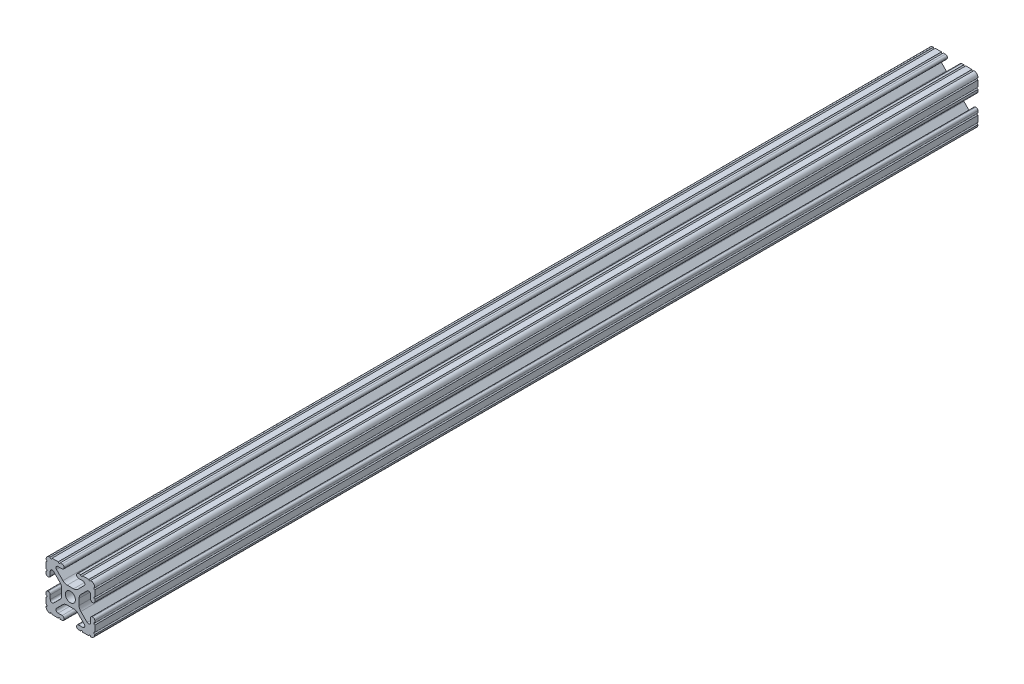
from build123d import *

# Parameters (mm, degrees)
SKETCH1_R           = 2.6035
BOSS_EXTRUDE1_DEPTH = 229.87


with BuildPart() as part:
    # Sketch1 → Boss-Extrude1 (new, symmetric)
    with BuildSketch(Plane.XY):
        with BuildLine():
            Line((-7.179650497, -8.645192506), (-3.952270251, -5.423690499))
            ThreePointArc((-3.952270251, -5.423690499), (-2.922936451, -4.736929036), (-1.709253557, -4.4958))
            Line((-1.709253557, -4.4958), (1.709253557, -4.4958))
            ThreePointArc((1.709253557, -4.4958), (2.922936451, -4.736929036), (3.952270251, -5.423690499))
            Line((3.952270251, -5.423690499), (7.179650497, -8.645192506))
            ThreePointArc((7.179650497, -8.645192506), (7.41473083, -9.822813117), (6.416408329, -10.4902))
            Line((6.416408329, -10.4902), (4.287512407, -10.4902))
            ThreePointArc((4.287512407, -10.4902), (3.54574862, -10.79744862), (3.2385, -11.539212407))
            Line((3.2385, -11.539212407), (3.2385, -11.650987593))
            ThreePointArc((3.2385, -11.650987593), (3.54574862, -12.39275138), (4.287512407, -12.7))
            Line((4.287512407, -12.7), (5.317126718, -12.7))
            ThreePointArc((5.317126718, -12.7), (5.825126718, -12.192), (6.333126718, -12.7))
            Line((6.333126718, -12.7), (9.550443118, -12.7))
            ThreePointArc((9.550443118, -12.7), (10.058366869, -12.192000006), (10.566443095, -12.699847501))
            ThreePointArc((10.566443095, -12.699847501), (12.082537762, -12.08250727), (12.699846982, -10.566399977))
            ThreePointArc((12.699846982, -10.566399977), (12.192000006, -10.058323491), (12.7, -9.5504))
            Line((12.7, -9.5504), (12.7, -6.3330836))
            ThreePointArc((12.7, -6.3330836), (12.192, -5.8250836), (12.7, -5.3170836))
            Line((12.7, -5.3170836), (12.7, -4.287469289))
            ThreePointArc((12.7, -4.287469289), (12.39275138, -3.545705502), (11.650987593, -3.238456882))
            Line((11.650987593, -3.238456882), (11.539212407, -3.238456882))
            ThreePointArc((11.539212407, -3.238456882), (10.79744862, -3.545705502), (10.4902, -4.287469289))
            Line((10.4902, -4.287469289), (10.4902, -6.402089023))
            ThreePointArc((10.4902, -6.402089023), (9.856505071, -7.351067942), (8.737131347, -7.129408934))
            Line((8.737131347, -7.129408934), (5.441005833, -3.840816462))
            ThreePointArc((5.441005833, -3.840816462), (4.750877967, -2.809883091), (4.5085, -1.593185507))
            Line((4.5085, -1.593185507), (4.5085, 1.593185507))
            ThreePointArc((4.5085, 1.593185507), (4.750877967, 2.809883091), (5.441005833, 3.840816462))
            Line((5.441005833, 3.840816462), (8.737131347, 7.129408934))
            ThreePointArc((8.737131347, 7.129408934), (9.856505071, 7.351067942), (10.4902, 6.402089023))
            Line((10.4902, 6.402089023), (10.4902, 4.287469289))
            ThreePointArc((10.4902, 4.287469289), (10.79744862, 3.545705502), (11.539212407, 3.238456882))
            Line((11.539212407, 3.238456882), (11.650987593, 3.238456882))
            ThreePointArc((11.650987593, 3.238456882), (12.39275138, 3.545705502), (12.7, 4.287469289))
            Line((12.7, 4.287469289), (12.7, 5.3170836))
            ThreePointArc((12.7, 5.3170836), (12.192, 5.8250836), (12.7, 6.3330836))
            Line((12.7, 6.3330836), (12.7, 9.5504))
            ThreePointArc((12.7, 9.5504), (12.192000006, 10.058323491), (12.699846982, 10.566399977))
            ThreePointArc((12.699846982, 10.566399977), (12.082537762, 12.08250727), (10.566443095, 12.699847501))
            ThreePointArc((10.566443095, 12.699847501), (10.058366869, 12.192000006), (9.550443118, 12.7))
            Line((9.550443118, 12.7), (6.333126718, 12.7))
            ThreePointArc((6.333126718, 12.7), (5.825126718, 12.192), (5.317126718, 12.7))
            Line((5.317126718, 12.7), (4.287512407, 12.7))
            ThreePointArc((4.287512407, 12.7), (3.54574862, 12.39275138), (3.2385, 11.650987593))
            Line((3.2385, 11.650987593), (3.2385, 11.539212407))
            ThreePointArc((3.2385, 11.539212407), (3.54574862, 10.79744862), (4.287512407, 10.4902))
            Line((4.287512407, 10.4902), (6.476788598, 10.4902))
            ThreePointArc((6.476788598, 10.4902), (7.432222385, 9.85140422), (7.207036008, 8.724370562))
            Line((7.207036008, 8.724370562), (3.898272566, 5.423169045))
            ThreePointArc((3.898272566, 5.423169045), (2.869120213, 4.736787962), (1.655778399, 4.4958))
            Line((1.655778399, 4.4958), (-1.655778399, 4.4958))
            ThreePointArc((-1.655778399, 4.4958), (-2.869120213, 4.736787962), (-3.898272566, 5.423169045))
            Line((-3.898272566, 5.423169045), (-7.207036008, 8.724370562))
            ThreePointArc((-7.207036008, 8.724370562), (-7.432222385, 9.85140422), (-6.476788598, 10.4902))
            Line((-6.476788598, 10.4902), (-4.287512407, 10.4902))
            ThreePointArc((-4.287512407, 10.4902), (-3.54574862, 10.79744862), (-3.2385, 11.539212407))
            Line((-3.2385, 11.539212407), (-3.2385, 11.650987593))
            ThreePointArc((-3.2385, 11.650987593), (-3.54574862, 12.39275138), (-4.287512407, 12.7))
            Line((-4.287512407, 12.7), (-5.317126718, 12.7))
            ThreePointArc((-5.317126718, 12.7), (-5.825126718, 12.192), (-6.333126718, 12.7))
            Line((-6.333126718, 12.7), (-9.550443118, 12.7))
            ThreePointArc((-9.550443118, 12.7), (-10.058366869, 12.192000006), (-10.566443095, 12.699847501))
            ThreePointArc((-10.566443095, 12.699847501), (-12.082537762, 12.08250727), (-12.699846982, 10.566399977))
            ThreePointArc((-12.699846982, 10.566399977), (-12.192000006, 10.058323491), (-12.7, 9.5504))
            Line((-12.7, 9.5504), (-12.7, 6.3330836))
            ThreePointArc((-12.7, 6.3330836), (-12.192, 5.8250836), (-12.7, 5.3170836))
            Line((-12.7, 5.3170836), (-12.7, 4.287469289))
            ThreePointArc((-12.7, 4.287469289), (-12.39275138, 3.545705502), (-11.650987593, 3.238456882))
            Line((-11.650987593, 3.238456882), (-11.539212407, 3.238456882))
            ThreePointArc((-11.539212407, 3.238456882), (-10.79744862, 3.545705502), (-10.4902, 4.287469289))
            Line((-10.4902, 4.287469289), (-10.4902, 6.402089023))
            ThreePointArc((-10.4902, 6.402089023), (-9.856505071, 7.351067942), (-8.737131347, 7.129408934))
            Line((-8.737131347, 7.129408934), (-5.441005833, 3.840816462))
            ThreePointArc((-5.441005833, 3.840816462), (-4.750877967, 2.809883091), (-4.5085, 1.593185507))
            Line((-4.5085, 1.593185507), (-4.5085, -1.593185507))
            ThreePointArc((-4.5085, -1.593185507), (-4.750877967, -2.809883091), (-5.441005833, -3.840816462))
            Line((-5.441005833, -3.840816462), (-8.737131347, -7.129408934))
            ThreePointArc((-8.737131347, -7.129408934), (-9.856505071, -7.351067942), (-10.4902, -6.402089023))
            Line((-10.4902, -6.402089023), (-10.4902, -4.287469289))
            ThreePointArc((-10.4902, -4.287469289), (-10.79744862, -3.545705502), (-11.539212407, -3.238456882))
            Line((-11.539212407, -3.238456882), (-11.650987593, -3.238456882))
            ThreePointArc((-11.650987593, -3.238456882), (-12.39275138, -3.545705502), (-12.7, -4.287469289))
            Line((-12.7, -4.287469289), (-12.7, -5.3170836))
            ThreePointArc((-12.7, -5.3170836), (-12.192, -5.8250836), (-12.7, -6.3330836))
            Line((-12.7, -6.3330836), (-12.7, -9.5504))
            ThreePointArc((-12.7, -9.5504), (-12.192000006, -10.058323491), (-12.699846982, -10.566399977))
            ThreePointArc((-12.699846982, -10.566399977), (-12.082537762, -12.08250727), (-10.566443095, -12.699847501))
            ThreePointArc((-10.566443095, -12.699847501), (-10.058366869, -12.192000006), (-9.550443118, -12.7))
            Line((-9.550443118, -12.7), (-6.333126718, -12.7))
            ThreePointArc((-6.333126718, -12.7), (-5.825126718, -12.192), (-5.317126718, -12.7))
            Line((-5.317126718, -12.7), (-4.287512407, -12.7))
            ThreePointArc((-4.287512407, -12.7), (-3.54574862, -12.39275138), (-3.2385, -11.650987593))
            Line((-3.2385, -11.650987593), (-3.2385, -11.539212407))
            ThreePointArc((-3.2385, -11.539212407), (-3.54574862, -10.79744862), (-4.287512407, -10.4902))
            Line((-4.287512407, -10.4902), (-6.416408329, -10.4902))
            ThreePointArc((-6.416408329, -10.4902), (-7.41473083, -9.822813117), (-7.179650497, -8.645192506))
        make_face()
        Circle(SKETCH1_R, mode=Mode.SUBTRACT)
    extrude(amount=BOSS_EXTRUDE1_DEPTH, both=True)


solid = part.part
